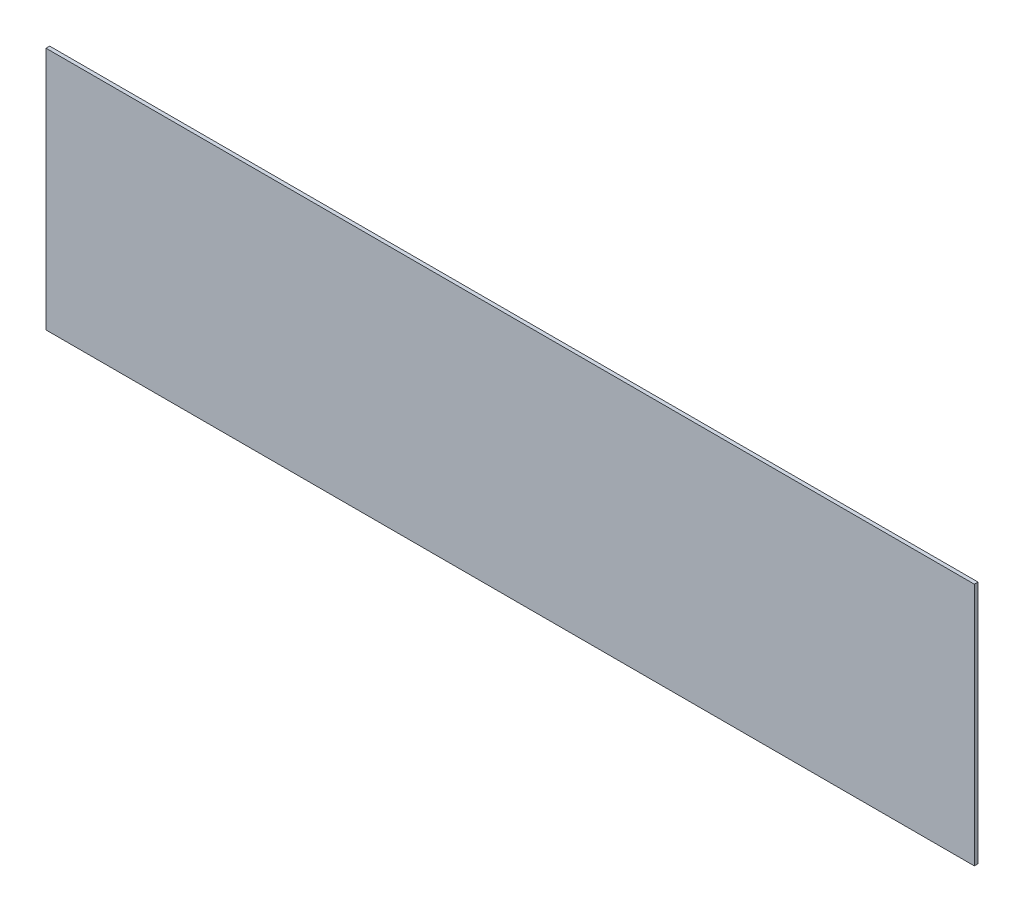
from build123d import *

# Parameters (mm, degrees)
SKETCH1_W           = 800.1
SKETCH1_H           = 210.312
BOSS_EXTRUDE1_DEPTH = 3.175


with BuildPart() as part:
    # Sketch1 → Boss-Extrude1 (new body)
    with BuildSketch(Plane.XY):
        with Locations((-400.05, 105.156)):
            Rectangle(SKETCH1_W, SKETCH1_H)
    extrude(amount=BOSS_EXTRUDE1_DEPTH)


solid = part.part
